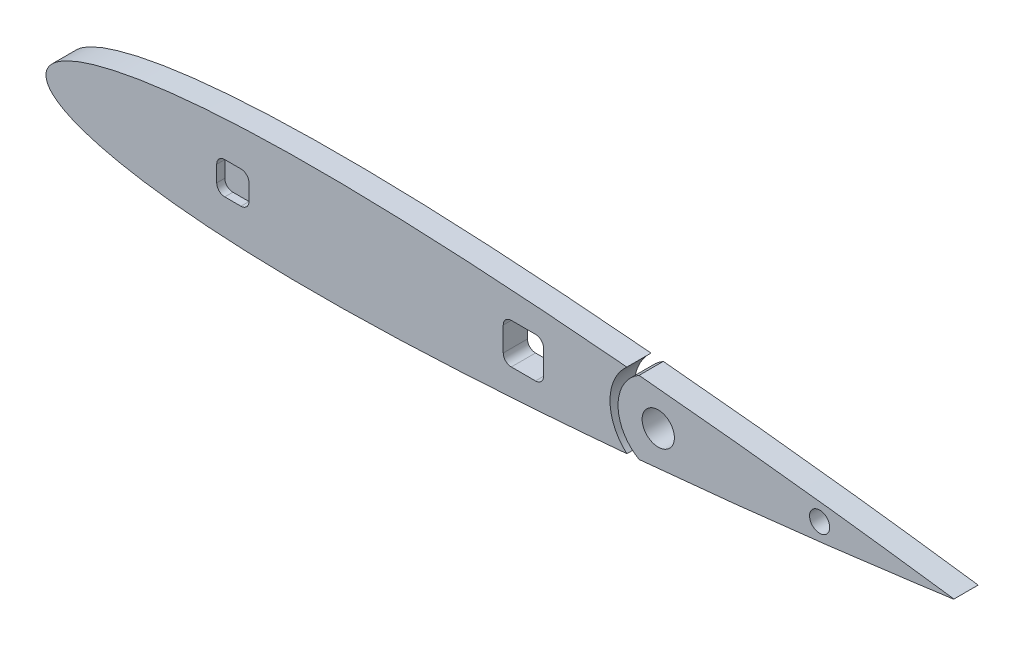
from build123d import *

# Parameters (mm, degrees)
RESSALTO_EXTRUS_O1_OUTLINE_R   = 4
RESSALTO_EXTRUS_O1_OUTLINE_R_2 = 2.5
RESSALTO_EXTRUS_O1_DEPTH       = 6
CORTE_EXTRUS_O1_DEPTH          = 2
CORTE_EXTRUS_O2_DEPTH          = 2


# Read off the part's stored shape, not the designer's step: Ressalto-extrusão1
with BuildPart() as part:
    # Ressalto-extrusão1 outline → Ressalto-extrusão1 (new body)
    # profile 1 of 2: a face of its own
    with BuildSketch(Plane.XY):
        with BuildLine():
            ThreePointArc((146.99, 9.029165979), (141.777008591, 0), (146.99, -9.029165979))
            add(Edge.make_bspline(
                [(146.99, -9.029165979), (148.337196309, -8.906015417), (151.348115525, -8.626831029), (155.987534716, -8.182777655), (160.870173109, -7.700720132), (165.637462146, -7.215393432), (170.278326288, -6.730539905), (174.781826014, -6.2470581), (179.137619624, -5.768403016), (183.335395872, -5.295860237), (187.365482473, -4.83281959), (191.218237662, -4.380463556), (194.884804675, -3.941502002), (198.356644789, -3.518228575), (201.625623904, -3.112532704), (204.684077394, -2.726512639), (207.524885018, -2.36286915), (210.14136538, -2.022521824), (212.527464364, -1.7082026), (214.67761399, -1.421387938), (216.586842947, -1.164136985), (218.250549273, -0.937549825), (219.665029799, -0.743094035), (220.826456392, -0.582872783), (221.733815917, -0.456686871), (222.380592332, -0.365976445), (222.774416409, -0.311430203), (223.595746131, -0.193373846), (224.99, -0.093639909), (224.99, 0), (224.99, 0.093639909), (223.595746131, 0.193373846), (222.774416409, 0.311430203), (222.380592332, 0.365976445), (221.733815917, 0.456686871), (220.826456392, 0.582872783), (219.665029799, 0.743094035), (218.250549273, 0.937549825), (216.586842947, 1.164136985), (214.67761399, 1.421387938), (212.527464364, 1.7082026), (210.14136538, 2.022521824), (207.524885018, 2.36286915), (204.684077394, 2.726512639), (201.625623904, 3.112532704), (198.356644789, 3.518228575), (194.884804675, 3.941502002), (191.218237662, 4.380463556), (187.365482473, 4.83281959), (183.335395872, 5.295860237), (179.137619624, 5.768403016), (174.781826014, 6.2470581), (170.278326288, 6.730539905), (165.637462146, 7.215393432), (160.870173109, 7.700720132), (155.987534716, 8.182777655), (151.348115525, 8.626831029), (148.337196309, 8.906015417), (146.99, 9.029165979)],
                knots=[0.828821469, 0.828821469, 0.828821469, 0.828821469, 0.837668158, 0.848595748, 0.859299453, 0.869753257, 0.879932425, 0.889813425, 0.899372991, 0.908588481, 0.917438048, 0.925901016, 0.933956533, 0.941586686, 0.948773131, 0.955497933, 0.961746042, 0.967502103, 0.972752493, 0.97748467, 0.981687532, 0.98535058, 0.988465174, 0.99102363, 0.99302004, 0.994449737, 0.995308667, 0.995595321, 1, 1, 1, 1.004404679, 1.004691333, 1.005550263, 1.00697996, 1.00897637, 1.011534826, 1.01464942, 1.018312468, 1.02251533, 1.027247507, 1.032497897, 1.038253958, 1.044502067, 1.051226869, 1.058413314, 1.066043467, 1.074098984, 1.082561952, 1.091411519, 1.100627009, 1.110186575, 1.120067575, 1.130246743, 1.140700547, 1.151404252, 1.162331842, 1.171178531, 1.171178531, 1.171178531, 1.171178531], degree=3))
        make_face()
        with Locations((151.74, 0)):
            Circle(RESSALTO_EXTRUS_O1_OUTLINE_R, mode=Mode.SUBTRACT)
        with Locations((191.74, 0)):
            Circle(RESSALTO_EXTRUS_O1_OUTLINE_R_2, mode=Mode.SUBTRACT)
    # profile 2 of 2: a face of its own
    with BuildSketch(Plane.XY):
        with BuildLine():
            add(Edge.make_bspline(
                [(143.964994718, 9.302712481), (142.90509191, 9.397499692), (140.101619629, 9.645212543), (135.535393921, 10.034885393), (130.251617052, 10.465572126), (124.924069364, 10.878081993), (119.565125585, 11.269103587), (114.187379479, 11.636184419), (108.803384618, 11.97639239), (103.425603277, 12.286441798), (98.066695173, 12.563880807), (92.739053945, 12.805680563), (87.455166071, 13.009147456), (82.227451256, 13.172022599), (77.068080741, 13.291408803), (71.989099485, 13.365201426), (67.002246064, 13.391326373), (62.119265292, 13.368231286), (57.351585182, 13.294877783), (52.710377932, 13.169049052), (48.20637983, 12.991301931), (43.85010036, 12.760359239), (39.651681503, 12.476868277), (35.621009576, 12.140888181), (31.767455659, 11.753029561), (28.099973601, 11.314763782), (24.627018393, 10.827872246), (21.356771486, 10.293262571), (18.296727667, 9.713606658), (15.453929575, 9.09108409), (12.835021062, 8.427805154), (10.445789101, 7.726741241), (8.291501945, 6.990220568), (6.376753729, 6.220786923), (4.705334783, 5.420659975), (3.280429379, 4.591505551), (2.103696759, 3.734729228), (1.177410691, 2.848921658), (0.503804939, 1.931573496), (0.091961319, 0.978200852), (-0.044825797, 0), (0.091961319, -0.978200852), (0.503804939, -1.931573496), (1.177410691, -2.848921658), (2.103696759, -3.734729228), (3.280429379, -4.591505551), (4.705334783, -5.420659975), (6.376753729, -6.220786923), (8.291501945, -6.990220568), (10.445789101, -7.726741241), (12.835021062, -8.427805154), (15.453929575, -9.09108409), (18.296727667, -9.713606658), (21.356771486, -10.293262571), (24.627018393, -10.827872246), (28.099973601, -11.314763782), (31.767455659, -11.753029561), (35.621009576, -12.140888181), (39.651681503, -12.476868277), (43.85010036, -12.760359239), (48.20637983, -12.991301931), (52.710377932, -13.169049052), (57.351585182, -13.294877783), (62.119265292, -13.368231286), (67.002246064, -13.391326373), (71.989099485, -13.365201426), (77.068080741, -13.291408803), (82.227451256, -13.172022599), (87.455166071, -13.009147456), (92.739053945, -12.805680563), (98.066695173, -12.563880807), (103.425603277, -12.286441798), (108.803384618, -11.97639239), (114.187379479, -11.636184419), (119.565125585, -11.269103587), (124.924069364, -10.878081993), (130.251617052, -10.465572126), (135.535393921, -10.034885393), (140.101619629, -9.645212543), (142.90509191, -9.397499692), (143.964994718, -9.302712481)],
                knots=[0.17779942, 0.17779942, 0.17779942, 0.17779942, 0.18475829, 0.196204076, 0.207768618, 0.219425945, 0.231147635, 0.242906359, 0.254675296, 0.26642621, 0.278132455, 0.289766477, 0.301301814, 0.312711646, 0.323969259, 0.33505005, 0.345928599, 0.356580621, 0.366981996, 0.377109776, 0.386942119, 0.396457905, 0.405636645, 0.41445907, 0.42290662, 0.430962851, 0.438611618, 0.445838275, 0.452630377, 0.458976173, 0.4648663, 0.470293868, 0.475254829, 0.479749124, 0.483781006, 0.48736258, 0.490515632, 0.493278566, 0.495712194, 0.497909944, 0.5, 0.502090056, 0.504287806, 0.506721434, 0.509484368, 0.51263742, 0.516218994, 0.520250876, 0.524745171, 0.529706132, 0.5351337, 0.541023827, 0.547369623, 0.554161725, 0.561388382, 0.569037149, 0.57709338, 0.58554093, 0.594363355, 0.603542095, 0.613057881, 0.622890224, 0.633018004, 0.643419379, 0.654071401, 0.66494995, 0.676030741, 0.687288354, 0.698698186, 0.710233523, 0.721867545, 0.73357379, 0.745324704, 0.757093641, 0.768852365, 0.780574055, 0.792231382, 0.803795924, 0.81524171, 0.82220058, 0.82220058, 0.82220058, 0.82220058], degree=3))
            ThreePointArc((143.964994718, -9.302712481), (139.777008591, 0), (143.964994718, 9.302712481))
        make_face()
        with BuildLine():
            Line((113.3233333, -3), (113.3233333, 3))
            ThreePointArc((113.3233333, 3), (113.909119738, 4.414213562), (115.3233333, 5))
            Line((115.3233333, 5), (121.3233333, 5))
            ThreePointArc((121.3233333, 5), (122.737546862, 4.414213562), (123.3233333, 3))
            Line((123.3233333, 3), (123.3233333, -3))
            ThreePointArc((123.3233333, -3), (122.737546862, -4.414213562), (121.3233333, -5))
            Line((121.3233333, -5), (115.3233333, -5))
            ThreePointArc((115.3233333, -5), (113.909119738, -4.414213562), (113.3233333, -3))
        make_face(mode=Mode.SUBTRACT)
    extrude(amount=RESSALTO_EXTRUS_O1_DEPTH)

    # Esboço3 → Corte-extrusão1 (cut)
    with BuildSketch(Plane(origin=(0, 0, 0), x_dir=(-1, 0, 0), z_dir=(0, 0, -1))):
        with BuildLine():
            Line((-13, -4), (-17, -4))
            ThreePointArc((-17, -4), (-18.414213562, -3.414213562), (-19, -2))
            Line((-19, -2), (-19, 2))
            ThreePointArc((-19, 2), (-18.414213562, 3.414213562), (-17, 4))
            Line((-17, 4), (-13, 4))
            ThreePointArc((-13, 4), (-11.585786438, 3.414213562), (-11, 2))
            Line((-11, 2), (-11, -2))
            ThreePointArc((-11, -2), (-11.585786438, -3.414213562), (-13, -4))
        make_face()
    extrude(amount=-CORTE_EXTRUS_O1_DEPTH, mode=Mode.SUBTRACT)

    # Esboço4 → Corte-extrusão2 (cut)
    with BuildSketch(Plane.XY.offset(6)):
        with BuildLine():
            Line((44.31, -4), (48.31, -4))
            ThreePointArc((48.31, -4), (49.724213562, -3.414213562), (50.31, -2))
            Line((50.31, -2), (50.31, 2))
            ThreePointArc((50.31, 2), (49.724213562, 3.414213562), (48.31, 4))
            Line((48.31, 4), (44.31, 4))
            ThreePointArc((44.31, 4), (42.895786438, 3.414213562), (42.31, 2))
            Line((42.31, 2), (42.31, -2))
            ThreePointArc((42.31, -2), (42.895786438, -3.414213562), (44.31, -4))
        make_face()
    extrude(amount=-CORTE_EXTRUS_O2_DEPTH, mode=Mode.SUBTRACT)


solid = part.part
